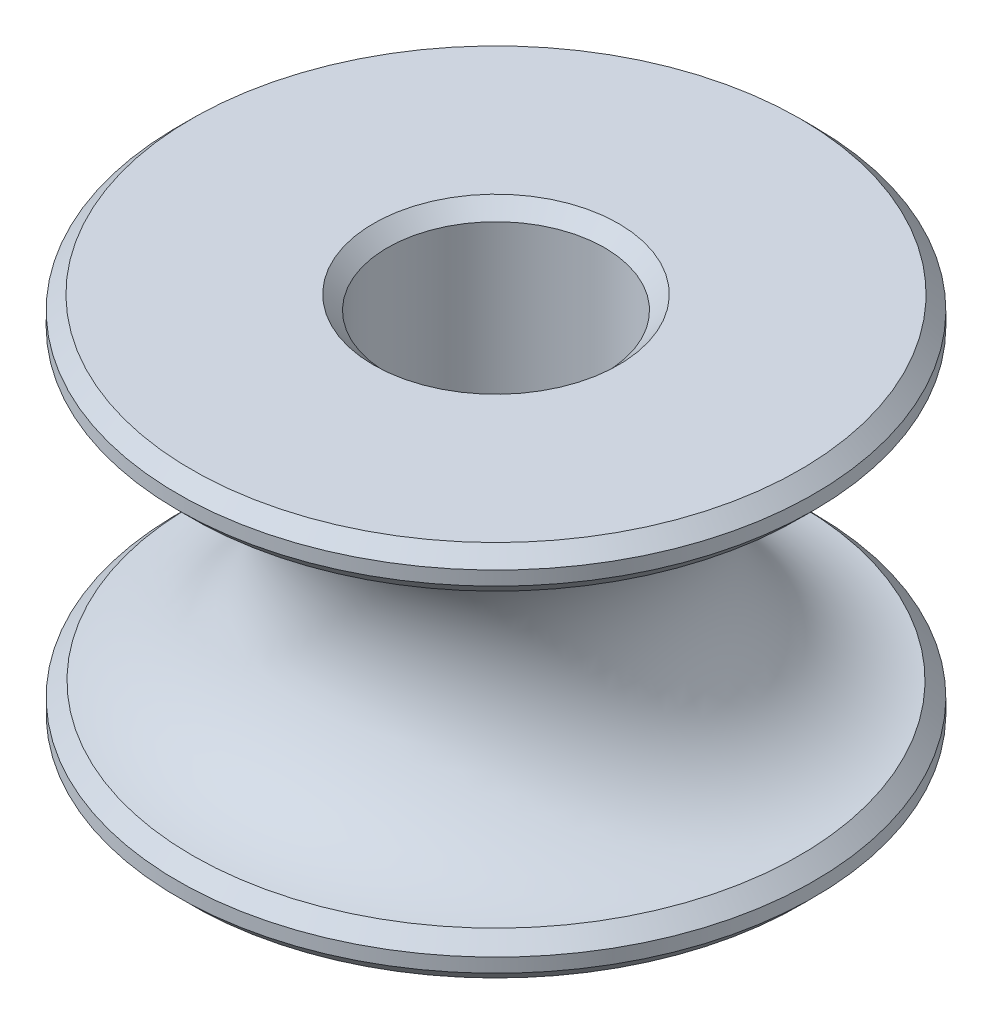
from build123d import *

# Parameters (mm, degrees)
CHAMFER1_SIZE = 1


with BuildPart() as part:
    # Sketch1 → Revolve1 (revolve)
    with BuildSketch(Plane(origin=(0, 0, 0), x_dir=(0, 0, -1), z_dir=(1, 0, 0))):
        with BuildLine():
            ThreePointArc((22.775, 24), (12.275, 13.5), (22.775, 3))
            Line((22.775, 3), (22.775, 0))
            Line((22.775, 0), (7.775, 0))
            Line((7.775, 0), (7.775, 27))
            Line((7.775, 27), (22.775, 27))
            Line((22.775, 27), (22.775, 24))
        make_face()
    revolve(axis=Axis((0, 0, 0), (0, 1, 0)))

    # Chamfer1
    # the kernel refuses this chamfer: 1 mm, written as the material it takes off along each edge
    with BuildSketch(Plane(origin=(0, 3, 0), x_dir=(0, 0, -1), z_dir=(1, 0, 0))) as chamfer1_piece_1:
        with BuildLine():
            Line((21.722073557, 0.052926443), (22.775, -CHAMFER1_SIZE))
            Line((22.775, -CHAMFER1_SIZE), (22.775, 0))
            ThreePointArc((22.775, 0), (22.233019365, 0.013997092), (21.722073557, 0.052926443))
        make_face()
    revolve(axis=Axis((0, 3, 0), (0, 1, 0)), mode=Mode.SUBTRACT)
    with BuildSketch(Plane(origin=(0, 0, 0), x_dir=(0, 0, -1), z_dir=(1, 0, 0))) as chamfer1_piece_2:
        Polygon((22.775, CHAMFER1_SIZE), (22.775 - CHAMFER1_SIZE, 0), (22.775, 0), align=None)
    revolve(axis=Axis((0, 0, 0), (0, 1, 0)), mode=Mode.SUBTRACT)
    with BuildSketch(Plane(origin=(0, 0, 0), x_dir=(0, 0, -1), z_dir=(1, 0, 0))) as chamfer1_piece_3:
        Polygon((7.775 + CHAMFER1_SIZE, 0), (7.775, CHAMFER1_SIZE), (7.775, 0), align=None)
    revolve(axis=Axis((0, 0, 0), (0, 1, 0)), mode=Mode.SUBTRACT)
    with BuildSketch(Plane(origin=(0, 27, 0), x_dir=(0, 0, -1), z_dir=(1, 0, 0))) as chamfer1_piece_4:
        Polygon((7.775, -CHAMFER1_SIZE), (7.775 + CHAMFER1_SIZE, 0), (7.775, 0), align=None)
    revolve(axis=Axis((0, 27, 0), (0, 1, 0)), mode=Mode.SUBTRACT)
    with BuildSketch(Plane(origin=(0, 27, 0), x_dir=(0, 0, -1), z_dir=(1, 0, 0))) as chamfer1_piece_5:
        Polygon((22.775 - CHAMFER1_SIZE, 0), (22.775, -CHAMFER1_SIZE), (22.775, 0), align=None)
    revolve(axis=Axis((0, 27, 0), (0, 1, 0)), mode=Mode.SUBTRACT)
    with BuildSketch(Plane(origin=(0, 24, 0), x_dir=(0, 0, -1), z_dir=(1, 0, 0))) as chamfer1_piece_6:
        with BuildLine():
            Line((21.722073557, -0.052926443), (22.775, CHAMFER1_SIZE))
            Line((22.775, CHAMFER1_SIZE), (22.775, 0))
            ThreePointArc((22.775, 0), (22.233019365, -0.013997092), (21.722073557, -0.052926443))
        make_face()
    revolve(axis=Axis((0, 24, 0), (0, 1, 0)), mode=Mode.SUBTRACT)


solid = part.part
